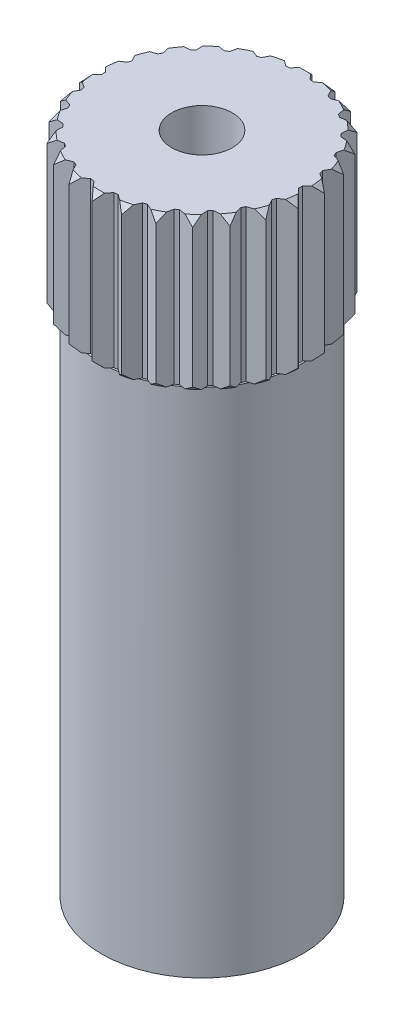
from build123d import *

# Parameters (mm, degrees)
SHAFTS_R              = 2.9
SHAFT_DEPTH           = 13.5
SHAFTEXTENSIONS_R     = 2.6
SHAFT_EXTENSION_DEPTH = 4
TOOTH_REACH           = 19.974
TOOTH_CP_COUNT        = 26
SMALLBORES_R          = 0.8
SMALL_BORE_DEPTH      = 4
SHAFTUNDERCUTS_W      = 0.25
SHAFTUNDERCUTS_H      = 13.5


with BuildPart() as part:
    # ShaftS → SHAFT (new body)
    with BuildSketch(Plane(origin=(0, 0, 0), x_dir=(1, 0, 0), z_dir=(0, 1, 0))):
        Circle(SHAFTS_R)
    extrude(amount=SHAFT_DEPTH)

    # ShaftExtensionS → SHAFT EXTENSION (add)
    with BuildSketch(Plane(origin=(0, 13.5, 0), x_dir=(1, 0, 0), z_dir=(0, 1, 0))):
        Circle(SHAFTEXTENSIONS_R)
    extrude(amount=SHAFT_EXTENSION_DEPTH)

    # ToothS → TOOTH (add, up to next)
    with BuildSketch(Plane(origin=(0, 17.5, 0), x_dir=(1, 0, 0), z_dir=(0, 1, 0)), mode=Mode.PRIVATE) as tooth_sk1:
        with BuildLine():
            Line((0, 2.9), (-0.262912611, 2.586672952))
            ThreePointArc((-0.262912611, 2.586672952), (0, 2.6), (0.262912611, 2.586672952))
            Line((0.262912611, 2.586672952), (0, 2.9))
        make_face()
    tooth_tool1 = extrude(tooth_sk1.sketch, amount=-TOOTH_REACH, mode=Mode.PRIVATE) - part.part
    tooth = tooth_tool1.solids().sort_by_distance((0, 17.5, -2.697077))[0]
    add(tooth)

    # TOOTH CP: TOOTH ×26 about axis
    tooth_cp_axis = Axis((0, 17.5, 0), (0, -1, 0))
    for i in range(1, TOOTH_CP_COUNT):
        add(tooth.rotate(tooth_cp_axis, i * 360 / TOOTH_CP_COUNT))

    # SmallBoreS → SMALL BORE (cut)
    with BuildSketch(Plane(origin=(0, 17.5, 0), x_dir=(1, 0, 0), z_dir=(0, 1, 0))):
        Circle(SMALLBORES_R)
    extrude(amount=-SMALL_BORE_DEPTH, mode=Mode.SUBTRACT)

    # ShaftUnderCutS → SHAFT UNDER CUT (revolve, cut)
    with BuildSketch(Plane.XY):
        with Locations((2.775, 6.75)):
            Rectangle(SHAFTUNDERCUTS_W, SHAFTUNDERCUTS_H)
    revolve(axis=Axis((0, 13.5, 0), (0, -1, 0)), mode=Mode.SUBTRACT)

    # TeethChamferS → TEETH CHAMFER (revolve, cut)
    with BuildSketch(Plane(origin=(0, 0, 0), x_dir=(0, 0, -1), z_dir=(1, 0, 0))):
        Polygon((2.9, 17.323223305), (2.9, 17.5), (2.723223305, 17.5), align=None)
        Polygon((2.723223305, 13.5), (2.9, 13.676776695), (2.9, 13.5), align=None)
    revolve(axis=Axis((0, 13.5, 0), (0, 1, 0)), mode=Mode.SUBTRACT)


solid = part.part
